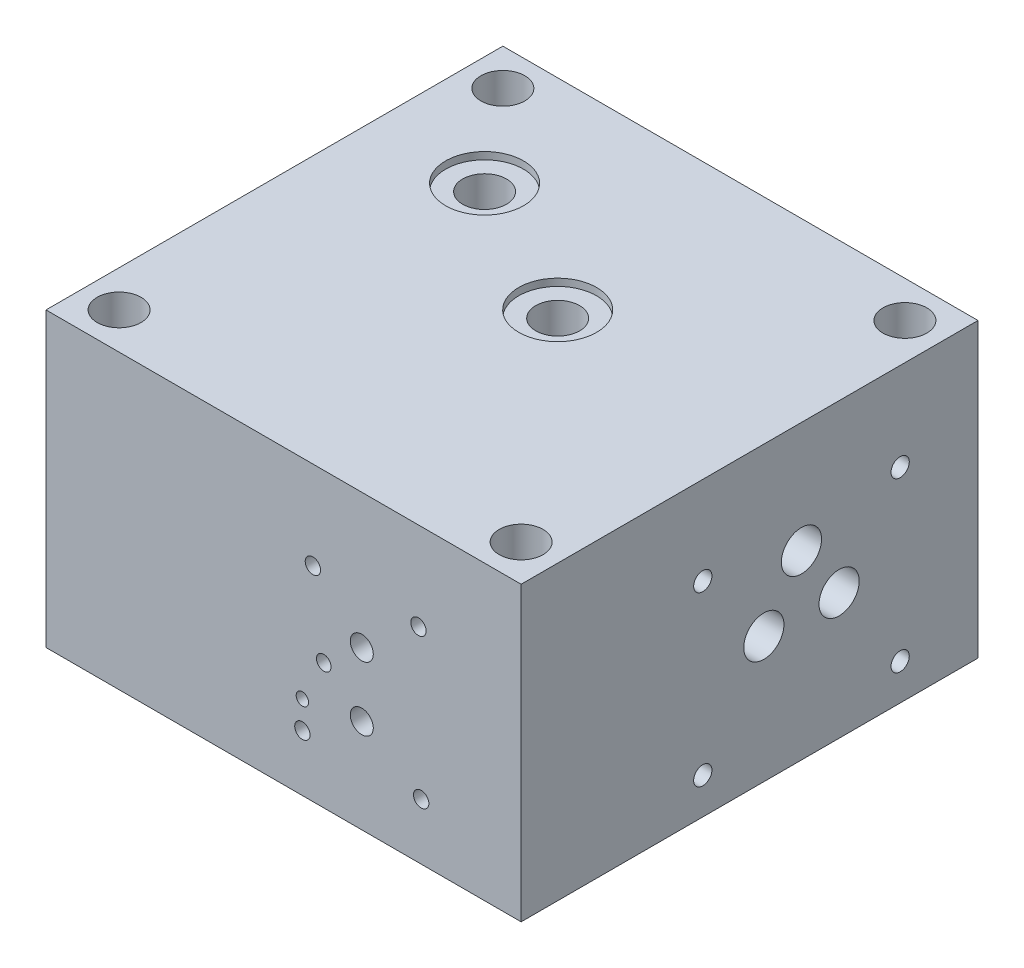
from build123d import *

# Parameters (mm, degrees)
SKETCH_1_W                       = 130
SKETCH_1_H                       = 125
EXTRUDE_1_DEPTH                  = 80
SKETCH_8_R                       = 6
CUT_EXTRUDE_1_DEPTH              = 121.545634512
SKETCH_9_R                       = 6
CUT_EXTRUDE_3_DEPTH              = 121.545634512
SKETCH_11_R                      = 6
CUT_EXTRUDE_4_DEPTH              = 121.545634512
SKETCH_12_R                      = 6
CUT_EXTRUDE_5_DEPTH              = 121.545634512
HOLE_WIZARD_M5_1_D               = 4.2
HOLE_WIZARD_M5_1_DEPTH           = 10
HOLE_WIZARD_M5_1_TIP             = 1.2618073
HOLE_WIZARD_M5_2_D               = 4.2
HOLE_WIZARD_M5_2_DEPTH           = 10
HOLE_WIZARD_M5_2_TIP             = 1.2618073
HOLE_WIZARD_M5_3_D               = 4.2
HOLE_WIZARD_M5_3_DEPTH           = 10
HOLE_WIZARD_M5_3_TIP             = 1.2618073
HOLE_WIZARD_M5_4_D               = 4.2
HOLE_WIZARD_M5_4_DEPTH           = 10
HOLE_WIZARD_M5_4_TIP             = 1.2618073
HOLE_WIZARD_1_64_0_01563_1_D     = 3.400000058
HOLE_WIZARD_1_64_0_01563_1_DEPTH = 9
HOLE_WIZARD_1_64_0_01563_1_TIP   = 1.02146307
SKETCH_21_R                      = 10.65
CUT_EXTRUDE_6_DEPTH              = 1.97
SKETCH_22_R                      = 6
CUT_EXTRUDE_7_DEPTH              = 120.247351753
SKETCH_23_R                      = 10.65
CUT_EXTRUDE_8_DEPTH              = 1.97
SKETCH_24_R                      = 6
CUT_EXTRUDE_9_DEPTH              = 120.247351753
HOLE_WIZARD_M6_1_D               = 5
HOLE_WIZARD_M6_1_DEPTH           = 10
HOLE_WIZARD_M6_1_TIP             = 1.502151548
HOLE_WIZARD_M6_3_D               = 5
HOLE_WIZARD_M6_3_DEPTH           = 10
HOLE_WIZARD_M6_3_TIP             = 1.502151548
HOLE_WIZARD_M6_4_D               = 5
HOLE_WIZARD_M6_4_DEPTH           = 10
HOLE_WIZARD_M6_4_TIP             = 1.502151548
HOLE_WIZARD_M6_5_D               = 5
HOLE_WIZARD_M6_5_DEPTH           = 10
HOLE_WIZARD_M6_5_TIP             = 1.502151548
MM_1_D                           = 11
MM_1_DEPTH                       = 70
MM_1_TIP                         = 3.304733405
MM_2_D                           = 11
MM_2_DEPTH                       = 45
MM_2_TIP                         = 3.304733405
MM_3_D                           = 11
MM_3_DEPTH                       = 90.55
MM_3_TIP                         = 3.304733405
MM_4_D                           = 11
MM_4_DEPTH                       = 25.51
MM_4_TIP                         = 3.304733405
MM_5_D                           = 11
MM_5_DEPTH                       = 35
MM_5_TIP                         = 3.304733405
M16X1_5_1_D                      = 14.5
M16X1_5_1_DEPTH                  = 14
M16X1_5_1_TIP                    = 4.356239488
M16X1_5_2_D                      = 14.5
M16X1_5_2_DEPTH                  = 14
M16X1_5_2_TIP                    = 4.356239488
HOLE_WIZARD_M6_6_D               = 5
HOLE_WIZARD_M6_6_DEPTH           = 10
HOLE_WIZARD_M6_6_TIP             = 1.502151548
HOLE_WIZARD_M6_7_D               = 5
HOLE_WIZARD_M6_7_DEPTH           = 10
HOLE_WIZARD_M6_7_TIP             = 1.502151548
HOLE_WIZARD_M6_8_D               = 5
HOLE_WIZARD_M6_8_DEPTH           = 10
HOLE_WIZARD_M6_8_TIP             = 1.502151548
MM_9_D                           = 4
MM_9_DEPTH                       = 70.44
MM_9_TIP                         = 1.201721238
HOLE_WIZARD_M6_9_D               = 5
HOLE_WIZARD_M6_9_DEPTH           = 10
HOLE_WIZARD_M6_9_TIP             = 1.502151548
MM_6_D                           = 11
MM_6_DEPTH                       = 40
MM_6_TIP                         = 3.304733405
MM_7_D                           = 11
MM_7_DEPTH                       = 43.6
MM_7_TIP                         = 3.304733405
MM_8_D                           = 11
MM_8_DEPTH                       = 80
MM_8_TIP                         = 3.304733405
CUT_EXTRUDE_13_REACH             = 164.019
CUT_EXTRUDE_13_END_RADIUS        = 5.5
SKETCH_53_R                      = 3.15
MM_10_D                          = 6.3
MM_10_DEPTH                      = 69.55
MM_10_TIP                        = 1.89271095
CUT_EXTRUDE_14_REACH             = 164.019
CUT_EXTRUDE_14_END_RADIUS        = 5.5
SKETCH_57_R                      = 5.5
MM_11_D                          = 11
MM_11_DEPTH                      = 55.7
MM_11_TIP                        = 3.304733405
CUT_EXTRUDE_15_REACH             = 164.019
CUT_EXTRUDE_15_END_RADIUS        = 5.5
SKETCH_39_R                      = 4
HOLE_WIZARD_M10_6_D              = 8.5
HOLE_WIZARD_M10_6_DEPTH          = 10
HOLE_WIZARD_M10_6_TIP            = 2.553657631


# Read off the part's stored shape, not the designer's step: 打孔尺寸(%根据)内六角花形半沉头螺钉的类型1
with BuildPart() as part:
    # 草图1 → 凸台-拉伸1 (new body)
    with BuildSketch(Plane(origin=(0, 0, 0), x_dir=(1, 0, 0), z_dir=(0, 1, 0))):
        Rectangle(SKETCH_1_W, SKETCH_1_H)
    extrude(amount=EXTRUDE_1_DEPTH)

    # 草图8 → 切除-拉伸1 (cut, through all)
    with BuildSketch(Plane(origin=(0, 80, 0), x_dir=(1, 0, 0), z_dir=(0, 1, 0))):
        with Locations(Location((-55, 52.5, 0), (0, 0, 270))):
            Circle(SKETCH_8_R)
    extrude(amount=-CUT_EXTRUDE_1_DEPTH, mode=Mode.SUBTRACT)

    # 草图9 → 切除-拉伸3 (cut, through all)
    with BuildSketch(Plane(origin=(0, 80, 0), x_dir=(1, 0, 0), z_dir=(0, 1, 0))):
        with Locations(Location((55, 52.5, 0), (0, 0, 270))):
            Circle(SKETCH_9_R)
    extrude(amount=-CUT_EXTRUDE_3_DEPTH, mode=Mode.SUBTRACT)

    # 草图11 → 切除-拉伸4 (cut, through all)
    with BuildSketch(Plane(origin=(0, 80, 0), x_dir=(1, 0, 0), z_dir=(0, 1, 0))):
        with Locations(Location((-55, -52.5, 0), (0, 0, 270))):
            Circle(SKETCH_11_R)
    extrude(amount=-CUT_EXTRUDE_4_DEPTH, mode=Mode.SUBTRACT)

    # 草图12 → 切除-拉伸5 (cut, through all)
    with BuildSketch(Plane(origin=(0, 80, 0), x_dir=(1, 0, 0), z_dir=(0, 1, 0))):
        with Locations(Location((55, -52.5, 0), (0, 0, 270))):
            Circle(SKETCH_12_R)
    extrude(amount=-CUT_EXTRUDE_5_DEPTH, mode=Mode.SUBTRACT)

    # M5 螺纹孔1
    with Locations(Plane(origin=(37.65, 15.4, 62.5), x_dir=(1, 0, 0), z_dir=(0, 0, 1))):
        with Locations((0, 0)):
            Hole(HOLE_WIZARD_M5_1_D / 2, depth=HOLE_WIZARD_M5_1_DEPTH)
            with Locations((0, 0, -(HOLE_WIZARD_M5_1_DEPTH + HOLE_WIZARD_M5_1_TIP / 2))):  # 118° drill point
                Cone(0, HOLE_WIZARD_M5_1_D / 2, HOLE_WIZARD_M5_1_TIP, mode=Mode.SUBTRACT)

    # M5 螺纹孔2
    with Locations(Plane(origin=(5.15, 15.4, 62.5), x_dir=(1, 0, 0), z_dir=(0, 0, 1))):
        with Locations((0, 0)):
            Hole(HOLE_WIZARD_M5_2_D / 2, depth=HOLE_WIZARD_M5_2_DEPTH)
            with Locations((0, 0, -(HOLE_WIZARD_M5_2_DEPTH + HOLE_WIZARD_M5_2_TIP / 2))):  # 118° drill point
                Cone(0, HOLE_WIZARD_M5_2_D / 2, HOLE_WIZARD_M5_2_TIP, mode=Mode.SUBTRACT)

    # M5 螺纹孔3
    with Locations(Plane(origin=(36.9, 55.9, 62.5), x_dir=(1, 0, 0), z_dir=(0, 0, 1))):
        with Locations((0, 0)):
            Hole(HOLE_WIZARD_M5_3_D / 2, depth=HOLE_WIZARD_M5_3_DEPTH)
            with Locations((0, 0, -(HOLE_WIZARD_M5_3_DEPTH + HOLE_WIZARD_M5_3_TIP / 2))):  # 118° drill point
                Cone(0, HOLE_WIZARD_M5_3_D / 2, HOLE_WIZARD_M5_3_TIP, mode=Mode.SUBTRACT)

    # M5 螺纹孔4
    with Locations(Plane(origin=(8.017969318, 55.9, 62.5), x_dir=(1, 0, 0), z_dir=(0, 0, 1))):
        with Locations((0, 0)):
            Hole(HOLE_WIZARD_M5_4_D / 2, depth=HOLE_WIZARD_M5_4_DEPTH)
            with Locations((0, 0, -(HOLE_WIZARD_M5_4_DEPTH + HOLE_WIZARD_M5_4_TIP / 2))):  # 118° drill point
                Cone(0, HOLE_WIZARD_M5_4_D / 2, HOLE_WIZARD_M5_4_TIP, mode=Mode.SUBTRACT)

    # 1/64 (0.01563) 直径孔1
    with Locations(Plane(origin=(5.15, 22.9, 62.5), x_dir=(1, 0, 0), z_dir=(0, 0, 1))):
        with Locations((0, 0)):
            Hole(HOLE_WIZARD_1_64_0_01563_1_D / 2, depth=HOLE_WIZARD_1_64_0_01563_1_DEPTH)
            with Locations((0, 0, -(HOLE_WIZARD_1_64_0_01563_1_DEPTH + HOLE_WIZARD_1_64_0_01563_1_TIP / 2))):  # 118° drill point
                Cone(0, HOLE_WIZARD_1_64_0_01563_1_D / 2, HOLE_WIZARD_1_64_0_01563_1_TIP, mode=Mode.SUBTRACT)

    # 草图21 → 切除-拉伸6 (cut)
    with BuildSketch(Plane(origin=(0, 80, 0), x_dir=(1, 0, 0), z_dir=(0, 1, 0))):
        with Locations(Location((-35, 27.5, 0), (0, 0, 270))):
            Circle(SKETCH_21_R)
    extrude(amount=-CUT_EXTRUDE_6_DEPTH, mode=Mode.SUBTRACT)

    # 草图22 → 切除-拉伸7 (cut, through all)
    with BuildSketch(Plane(origin=(0, 78.03, 0), x_dir=(1, 0, 0), z_dir=(0, 1, 0))):
        with Locations(Location((-35, 27.5, 0), (0, 0, 270))):
            Circle(SKETCH_22_R)
    extrude(amount=-CUT_EXTRUDE_7_DEPTH, mode=Mode.SUBTRACT)

    # 草图23 → 切除-拉伸8 (cut)
    with BuildSketch(Plane(origin=(0, 80, 0), x_dir=(1, 0, 0), z_dir=(0, 1, 0))):
        with Locations(Location((5, 7.5, 0), (0, 0, 270))):
            Circle(SKETCH_23_R)
    extrude(amount=-CUT_EXTRUDE_8_DEPTH, mode=Mode.SUBTRACT)

    # 草图24 → 切除-拉伸9 (cut, through all)
    with BuildSketch(Plane(origin=(0, 78.03, 0), x_dir=(1, 0, 0), z_dir=(0, 1, 0))):
        with Locations(Location((5, 7.5, 0), (0, 0, 270))):
            Circle(SKETCH_24_R)
    extrude(amount=-CUT_EXTRUDE_9_DEPTH, mode=Mode.SUBTRACT)

    # M6 螺纹孔1
    with Locations(Plane(origin=(-65, 66.9, -29), x_dir=(0, 0, -1), z_dir=(-1, 0, 0))):
        with Locations((0, 0)):
            Hole(HOLE_WIZARD_M6_1_D / 2, depth=HOLE_WIZARD_M6_1_DEPTH)
            with Locations((0, 0, -(HOLE_WIZARD_M6_1_DEPTH + HOLE_WIZARD_M6_1_TIP / 2))):  # 118° drill point
                Cone(0, HOLE_WIZARD_M6_1_D / 2, HOLE_WIZARD_M6_1_TIP, mode=Mode.SUBTRACT)

    # M6 螺纹孔3
    with Locations(Plane(origin=(-65, 66.9, 25), x_dir=(0, 0, -1), z_dir=(-1, 0, 0))):
        with Locations((0, 0)):
            Hole(HOLE_WIZARD_M6_3_D / 2, depth=HOLE_WIZARD_M6_3_DEPTH)
            with Locations((0, 0, -(HOLE_WIZARD_M6_3_DEPTH + HOLE_WIZARD_M6_3_TIP / 2))):  # 118° drill point
                Cone(0, HOLE_WIZARD_M6_3_D / 2, HOLE_WIZARD_M6_3_TIP, mode=Mode.SUBTRACT)

    # M6 螺纹孔4
    with Locations(Plane(origin=(-65, 20.9, 25), x_dir=(0, 0, -1), z_dir=(-1, 0, 0))):
        with Locations((0, 0)):
            Hole(HOLE_WIZARD_M6_4_D / 2, depth=HOLE_WIZARD_M6_4_DEPTH)
            with Locations((0, 0, -(HOLE_WIZARD_M6_4_DEPTH + HOLE_WIZARD_M6_4_TIP / 2))):  # 118° drill point
                Cone(0, HOLE_WIZARD_M6_4_D / 2, HOLE_WIZARD_M6_4_TIP, mode=Mode.SUBTRACT)

    # M6 螺纹孔5
    with Locations(Plane(origin=(-65, 20.9, -29), x_dir=(0, 0, -1), z_dir=(-1, 0, 0))):
        with Locations((0, 0)):
            Hole(HOLE_WIZARD_M6_5_D / 2, depth=HOLE_WIZARD_M6_5_DEPTH)
            with Locations((0, 0, -(HOLE_WIZARD_M6_5_DEPTH + HOLE_WIZARD_M6_5_TIP / 2))):  # 118° drill point
                Cone(0, HOLE_WIZARD_M6_5_D / 2, HOLE_WIZARD_M6_5_TIP, mode=Mode.SUBTRACT)

    # 大小mm 暗销孔1
    with Locations(Plane(origin=(-65, 60.6, -2), x_dir=(0, 0, -1), z_dir=(-1, 0, 0))):
        with Locations((0, 0)):
            Hole(MM_1_D / 2, depth=MM_1_DEPTH)
            with Locations((0, 0, -(MM_1_DEPTH + MM_1_TIP / 2))):  # 118° drill point
                Cone(0, MM_1_D / 2, MM_1_TIP, mode=Mode.SUBTRACT)

    # 大小mm 暗销孔2
    with Locations(Plane(origin=(-65, 45.5, -12.3), x_dir=(0, 0, -1), z_dir=(-1, 0, 0))):
        with Locations((0, 0)):
            Hole(MM_2_D / 2, depth=MM_2_DEPTH)
            with Locations((0, 0, -(MM_2_DEPTH + MM_2_TIP / 2))):  # 118° drill point
                Cone(0, MM_2_D / 2, MM_2_TIP, mode=Mode.SUBTRACT)

    # 大小mm 暗销孔3
    with Locations(Plane(origin=(-65, 45.5, 8.3), x_dir=(0, 0, -1), z_dir=(-1, 0, 0))):
        with Locations((0, 0)):
            Hole(MM_3_D / 2, depth=MM_3_DEPTH)
            with Locations((0, 0, -(MM_3_DEPTH + MM_3_TIP / 2))):  # 118° drill point
                Cone(0, MM_3_D / 2, MM_3_TIP, mode=Mode.SUBTRACT)

    # 大小mm 暗销孔4
    with Locations(Plane(origin=(-65, 34.4, -25.8), x_dir=(0, 0, -1), z_dir=(-1, 0, 0))):
        with Locations((0, 0)):
            Hole(MM_4_D / 2, depth=MM_4_DEPTH)
            with Locations((0, 0, -(MM_4_DEPTH + MM_4_TIP / 2))):  # 118° drill point
                Cone(0, MM_4_D / 2, MM_4_TIP, mode=Mode.SUBTRACT)

    # 大小mm 暗销孔5
    with Locations(Plane(origin=(-65, 34.4, 21.8), x_dir=(0, 0, -1), z_dir=(-1, 0, 0))):
        with Locations((0, 0)):
            Hole(MM_5_D / 2, depth=MM_5_DEPTH)
            with Locations((0, 0, -(MM_5_DEPTH + MM_5_TIP / 2))):  # 118° drill point
                Cone(0, MM_5_D / 2, MM_5_TIP, mode=Mode.SUBTRACT)

    # M16x1.5 螺纹孔1
    with Locations(Plane(origin=(30.5, 49.6, -62.5), x_dir=(-1, 0, 0), z_dir=(0, 0, -1))):
        with Locations((0, 0)):
            Hole(M16X1_5_1_D / 2, depth=M16X1_5_1_DEPTH)
            with Locations((0, 0, -(M16X1_5_1_DEPTH + M16X1_5_1_TIP / 2))):  # 118° drill point
                Cone(0, M16X1_5_1_D / 2, M16X1_5_1_TIP, mode=Mode.SUBTRACT)

    # M16x1.5 螺纹孔2
    with Locations(Plane(origin=(-15, 40, -62.5), x_dir=(-1, 0, 0), z_dir=(0, 0, -1))):
        with Locations((0, 0)):
            Hole(M16X1_5_2_D / 2, depth=M16X1_5_2_DEPTH)
            with Locations((0, 0, -(M16X1_5_2_DEPTH + M16X1_5_2_TIP / 2))):  # 118° drill point
                Cone(0, M16X1_5_2_D / 2, M16X1_5_2_TIP, mode=Mode.SUBTRACT)

    # M6 螺纹孔6
    with Locations(Plane(origin=(65, 9.9, -41.2), x_dir=(0, 0, 1), z_dir=(1, 0, 0))):
        with Locations((0, 0)):
            Hole(HOLE_WIZARD_M6_6_D / 2, depth=HOLE_WIZARD_M6_6_DEPTH)
            with Locations((0, 0, -(HOLE_WIZARD_M6_6_DEPTH + HOLE_WIZARD_M6_6_TIP / 2))):  # 118° drill point
                Cone(0, HOLE_WIZARD_M6_6_D / 2, HOLE_WIZARD_M6_6_TIP, mode=Mode.SUBTRACT)

    # M6 螺纹孔7
    with Locations(Plane(origin=(65, 55.9, -41.2), x_dir=(0, 0, 1), z_dir=(1, 0, 0))):
        with Locations((0, 0)):
            Hole(HOLE_WIZARD_M6_7_D / 2, depth=HOLE_WIZARD_M6_7_DEPTH)
            with Locations((0, 0, -(HOLE_WIZARD_M6_7_DEPTH + HOLE_WIZARD_M6_7_TIP / 2))):  # 118° drill point
                Cone(0, HOLE_WIZARD_M6_7_D / 2, HOLE_WIZARD_M6_7_TIP, mode=Mode.SUBTRACT)

    # M6 螺纹孔8
    with Locations(Plane(origin=(65, 55.9, 12.8), x_dir=(0, 0, 1), z_dir=(1, 0, 0))):
        with Locations((0, 0)):
            Hole(HOLE_WIZARD_M6_8_D / 2, depth=HOLE_WIZARD_M6_8_DEPTH)
            with Locations((0, 0, -(HOLE_WIZARD_M6_8_DEPTH + HOLE_WIZARD_M6_8_TIP / 2))):  # 118° drill point
                Cone(0, HOLE_WIZARD_M6_8_D / 2, HOLE_WIZARD_M6_8_TIP, mode=Mode.SUBTRACT)

    # 大小mm 暗销孔9
    with Locations(Plane(origin=(11, 34.4, 62.5), x_dir=(1, 0, 0), z_dir=(0, 0, 1))):
        with Locations((0, 0)):
            Hole(MM_9_D / 2, depth=MM_9_DEPTH)
            with Locations((0, 0, -(MM_9_DEPTH + MM_9_TIP / 2))):  # 118° drill point
                Cone(0, MM_9_D / 2, MM_9_TIP, mode=Mode.SUBTRACT)

    # M6 螺纹孔9
    with Locations(Plane(origin=(65, 9.9, 12.8), x_dir=(0, 0, 1), z_dir=(1, 0, 0))):
        with Locations((0, 0)):
            Hole(HOLE_WIZARD_M6_9_D / 2, depth=HOLE_WIZARD_M6_9_DEPTH)
            with Locations((0, 0, -(HOLE_WIZARD_M6_9_DEPTH + HOLE_WIZARD_M6_9_TIP / 2))):  # 118° drill point
                Cone(0, HOLE_WIZARD_M6_9_D / 2, HOLE_WIZARD_M6_9_TIP, mode=Mode.SUBTRACT)

    # 大小mm 暗销孔6
    with Locations(Plane(origin=(65, 49.6, -14.2), x_dir=(0, 0, 1), z_dir=(1, 0, 0))):
        with Locations((0, 0)):
            Hole(MM_6_D / 2, depth=MM_6_DEPTH)
            with Locations((0, 0, -(MM_6_DEPTH + MM_6_TIP / 2))):  # 118° drill point
                Cone(0, MM_6_D / 2, MM_6_TIP, mode=Mode.SUBTRACT)

    # 大小mm 暗销孔7
    with Locations(Plane(origin=(65, 34.5, -3.9), x_dir=(0, 0, 1), z_dir=(1, 0, 0))):
        with Locations((0, 0)):
            Hole(MM_7_D / 2, depth=MM_7_DEPTH)
            with Locations((0, 0, -(MM_7_DEPTH + MM_7_TIP / 2))):  # 118° drill point
                Cone(0, MM_7_D / 2, MM_7_TIP, mode=Mode.SUBTRACT)

    # 大小mm 暗销孔8
    with Locations(Plane(origin=(65, 34.5, -24.5), x_dir=(0, 0, 1), z_dir=(1, 0, 0))):
        with Locations((0, 0)):
            Hole(MM_8_D / 2, depth=MM_8_DEPTH)
            with Locations((0, 0, -(MM_8_DEPTH + MM_8_TIP / 2))):  # 118° drill point
                Cone(0, MM_8_D / 2, MM_8_TIP, mode=Mode.SUBTRACT)

    # 切除-拉伸13: up to this cylinder (the profile starts outside it)
    cut_extrude_13_end = Plane(origin=(21.4, 45.5, 8.3), z_dir=(-1, 0, 0)) * Cylinder(CUT_EXTRUDE_13_END_RADIUS, 340.038, mode=Mode.PRIVATE)
    # 草图53 → 切除-拉伸13 (cut, up to the surface)
    with BuildSketch(Plane.XY.offset(62.5), mode=Mode.PRIVATE) as cut_extrude_13_sk1:
        with Locations((21.4, 43.2)):
            Circle(SKETCH_53_R)
    cut_extrude_13_tool1 = extrude(cut_extrude_13_sk1.sketch, amount=-CUT_EXTRUDE_13_REACH, mode=Mode.PRIVATE) - cut_extrude_13_end
    add(cut_extrude_13_tool1.solids().sort_by_distance((21.4, 43.2, 62.5))[0], mode=Mode.SUBTRACT)

    # 大小mm 暗销孔10
    with Locations(Plane(origin=(21.4, 25.7, 62.5), x_dir=(1, 0, 0), z_dir=(0, 0, 1))):
        with Locations((0, 0)):
            Hole(MM_10_D / 2, depth=MM_10_DEPTH)
            with Locations((0, 0, -(MM_10_DEPTH + MM_10_TIP / 2))):  # 118° drill point
                Cone(0, MM_10_D / 2, MM_10_TIP, mode=Mode.SUBTRACT)

    # 切除-拉伸14: up to this cylinder (the profile starts outside it)
    cut_extrude_14_end = Plane(origin=(30.5, 49.6, -14.2), z_dir=(1, 0, 0)) * Cylinder(CUT_EXTRUDE_14_END_RADIUS, 340.038, mode=Mode.PRIVATE)
    # 草图57 → 切除-拉伸14 (cut, up to the surface)
    with BuildSketch(Plane(origin=(0, 0, -62.5), x_dir=(-1, 0, 0), z_dir=(0, 0, -1)), mode=Mode.PRIVATE) as cut_extrude_14_sk1:
        with Locations((-30.5, 49.6)):
            Circle(SKETCH_57_R)
    cut_extrude_14_tool1 = extrude(cut_extrude_14_sk1.sketch, amount=-CUT_EXTRUDE_14_REACH, mode=Mode.PRIVATE) - cut_extrude_14_end
    add(cut_extrude_14_tool1.solids().sort_by_distance((30.5, 49.6, -62.5))[0], mode=Mode.SUBTRACT)

    # 大小mm 暗销孔11
    with Locations(Plane(origin=(-15, 40, -62.5), x_dir=(-1, 0, 0), z_dir=(0, 0, -1))):
        with Locations((0, 0)):
            Hole(MM_11_D / 2, depth=MM_11_DEPTH)
            with Locations((0, 0, -(MM_11_DEPTH + MM_11_TIP / 2))):  # 118° drill point
                Cone(0, MM_11_D / 2, MM_11_TIP, mode=Mode.SUBTRACT)

    # 打孔尺寸(%根据)内六角花形半沉头螺钉的类型1 outline → 打孔尺寸(%根据)内六角花形半沉头螺钉的类型1 (revolve, cut)
    with BuildSketch(Plane(origin=(24.55, 0, -3.9), x_dir=(1, 0, 0), z_dir=(0, 0, 1))):
        Polygon((3.15, 1.85), (3.15, 29.991496516), (0, 29.991496516), (0, 0), (5, 0), align=None)
    revolve(axis=Axis((24.55, 0, -3.9), (0, 1, 0)), mode=Mode.SUBTRACT)

    # 切除-拉伸15: up to this cylinder (the profile starts outside it)
    cut_extrude_15_end = Plane(origin=(-35, 34.4, 21.8), z_dir=(-1, 0, 0)) * Cylinder(CUT_EXTRUDE_15_END_RADIUS, 340.038, mode=Mode.PRIVATE)
    # 草图39 → 切除-拉伸15 (cut, up to the surface)
    with BuildSketch(Plane(origin=(0, 0, -62.5), x_dir=(-1, 0, 0), z_dir=(0, 0, -1)), mode=Mode.PRIVATE) as cut_extrude_15_sk1:
        with Locations((35, 34.4)):
            Circle(SKETCH_39_R)
    cut_extrude_15_tool1 = extrude(cut_extrude_15_sk1.sketch, amount=-CUT_EXTRUDE_15_REACH, mode=Mode.PRIVATE) - cut_extrude_15_end
    add(cut_extrude_15_tool1.solids().sort_by_distance((-35, 34.4, -62.5))[0], mode=Mode.SUBTRACT)

    # M10 螺纹孔6
    with Locations(Plane(origin=(-35, 34.4, -62.5), x_dir=(-1, 0, 0), z_dir=(0, 0, -1))):
        with Locations((0, 0)):
            Hole(HOLE_WIZARD_M10_6_D / 2, depth=HOLE_WIZARD_M10_6_DEPTH)
            with Locations((0, 0, -(HOLE_WIZARD_M10_6_DEPTH + HOLE_WIZARD_M10_6_TIP / 2))):  # 118° drill point
                Cone(0, HOLE_WIZARD_M10_6_D / 2, HOLE_WIZARD_M10_6_TIP, mode=Mode.SUBTRACT)


solid = part.part
